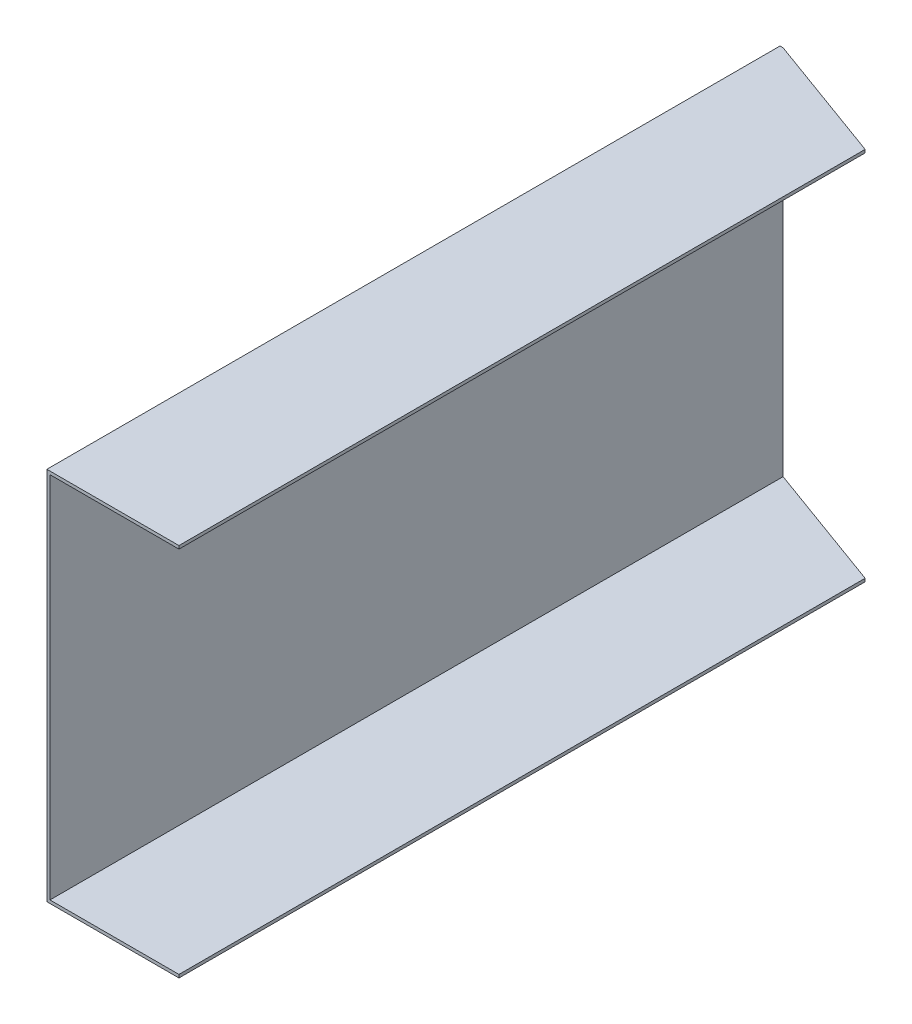
from build123d import *

# Parameters (mm, degrees)
BOSS_EXTRUDE1_DEPTH      = 21.59
BOSS_EXTRUDE1_DEPTH_BACK = 21.59
SKETCH3_W                = 241.554
SKETCH3_H                = 122.428
SHELL2_T                 = -1.016
CUT_EXTRUDE2_DEPTH       = 272.66721959
CUT_EXTRUDE2_DEPTH_BACK  = 272.66721959
MOVE_START               = -1.905
MOVE_FACE1_DEPTH         = 1.905


# Read off the part's stored shape, not the designer's step: Move Face1
with BuildPart() as part:
    # Sketch3 → Boss-Extrude1 (new, two sides: drawn at the far end of the back side and taken through both)
    with BuildSketch(Plane(origin=(0, 0, 0), x_dir=(0, 0, -1), z_dir=(1, 0, 0)).offset(-BOSS_EXTRUDE1_DEPTH_BACK)):
        with Locations((120.777, 61.214)):
            Rectangle(SKETCH3_W, SKETCH3_H)
    extrude(amount=BOSS_EXTRUDE1_DEPTH + BOSS_EXTRUDE1_DEPTH_BACK)

    # Shell2
    shell2_openings = [part.faces().sort_by_distance(p)[0] for p in [
        (21.59, 61.214, -120.777),
        (0, 61.214, -241.554),
        (0, 61.214, 0),
    ]]
    offset(amount=SHELL2_T, openings=shell2_openings, kind=Kind.INTERSECTION)

    # Sketch8 → Cut-Extrude2 (cut, two sides: drawn at the far end of the back side and taken through both)
    with BuildSketch(Plane(origin=(0, 122.428, 0), x_dir=(1, 0, 0), z_dir=(0, 1, 0)).offset(-CUT_EXTRUDE2_DEPTH_BACK)):
        Polygon((-490.808059193, 412.705200685), (-20.574, 241.554), (21.59, 226.207559042), (491.824059193, 55.056358358), (834.126460562, 995.524476744), (-148.505657824, 1353.173319071), align=None)
    extrude(amount=CUT_EXTRUDE2_DEPTH + CUT_EXTRUDE2_DEPTH_BACK, mode=Mode.SUBTRACT)

    # Move Face1 outline → Move Face1 (cut)
    with BuildSketch(Plane.XY.offset(MOVE_START)):
        Polygon((-21.59, 0), (21.59, 0), (21.59, 1.016), (-20.574, 1.016), (-20.574, 121.412), (21.59, 121.412), (21.59, 122.428), (-21.59, 122.428), align=None)
    extrude(amount=MOVE_FACE1_DEPTH, mode=Mode.SUBTRACT)


solid = part.part
